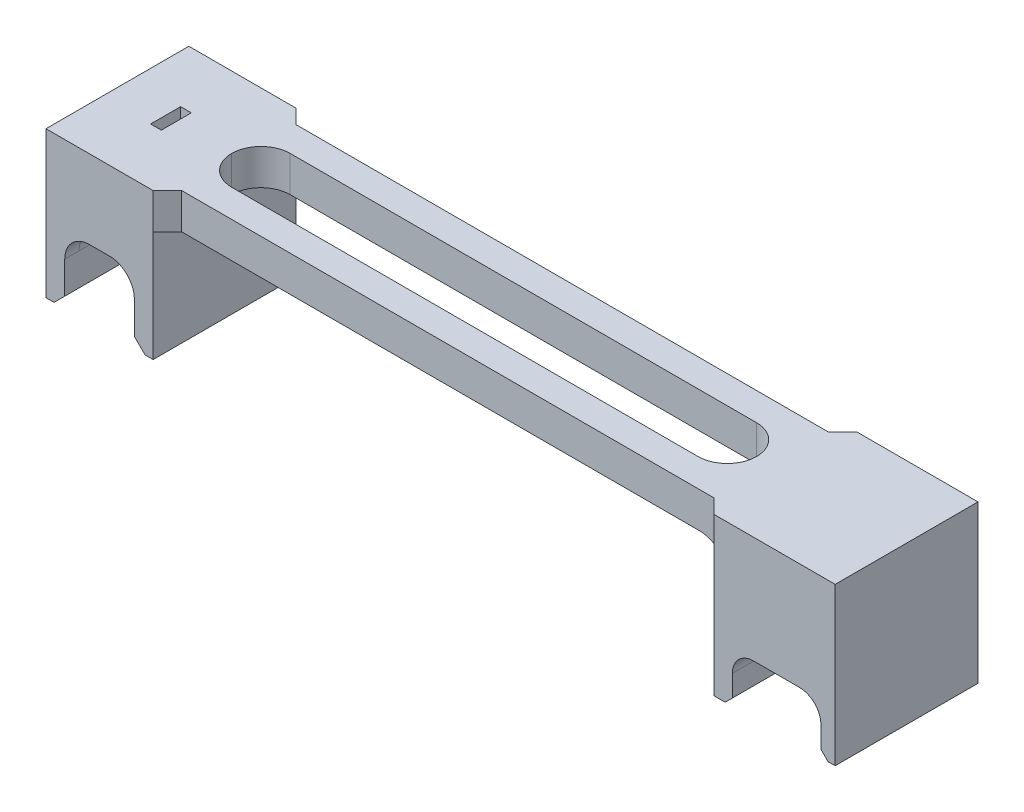
from build123d import *

# Parameters (mm, degrees)
EXTRUDE_1_DEPTH       = 16
SKETCH_4_W            = 1.5
SKETCH_4_H            = 4.2
SKETCH_4_W_2          = 73.5
SKETCH_4_H_2          = 8.2
CUT_EXTRUDE_1_DEPTH   = 10
FILLET_1_R            = 4.1
SKETCH_6_W            = 10
SKETCH_6_H            = 16
SKETCH_6_W_2          = 1.5
SKETCH_6_H_2          = 4.2
EXTRUDE_4_DEPTH       = 11
EXTRUDE_6_DEPTH       = 13
EXTRUDE_6_DEPTH_BACK  = 11
SKETCH_10_W           = 0.125
SKETCH_10_H           = 16
SKETCH_10_W_2         = 2.5
FILLET_2_R            = 3.5
EXTRUDE_7_DEPTH       = 2
EXTRUDE_8_DEPTH       = 2
FILLET_4_R            = 3.5
CUT_EXTRUDE_START     = -15
SKETCH_13_W           = 20
SKETCH_13_H           = 3.5
CUT_EXTRUDE_2_DEPTH   = 15
CHAMFER_1_SIZE        = 2
CHAMFER_2_SIZE        = 1.5
SKETCH_14_W           = 5
SKETCH_14_H           = 16
EXTRUDE_9_DEPTH       = 13
SKETCH_15_W           = 2.6
SKETCH_15_H           = 16
EXTRUDE_10_DEPTH      = 4
EXTRUDE_11_DEPTH      = 2
EXTRUDE_11_DEPTH_BACK = 18
CHAMFER_4_SIZE        = 2
SKETCH_19_W           = 12
SKETCH_19_H           = 20
EXTRUDE_12_DEPTH      = 26.5
SKETCH_20_W           = 10
SKETCH_20_H           = 20
CUT_EXTRUDE_3_DEPTH   = 8.5
FILLET_6_R            = 4
SKETCH_21_W           = 12.4
SKETCH_21_H           = 20
CUT_EXTRUDE_4_DEPTH   = 3
FILLET_7_R            = 3
SKETCH_22_W           = 20
SKETCH_22_H           = 4.5
CUT_EXTRUDE_5_DEPTH   = 3
CHAMFER_5_SIZE        = 1


# Some blends are built 0.0001 mm under size
with BuildPart() as part:
    # 스케치1 → 보스-돌출1 (new body)
    with BuildSketch(Plane.XY):
        Polygon((-96, 0), (0, 0), (0, -21.5), (7.6, -21.5), (7.6, 5), (-96, 5), align=None)
    extrude(amount=EXTRUDE_1_DEPTH)

    # 스케치4 → 컷-돌출1 (cut)
    with BuildSketch(Plane.XZ):
        with Locations((-91, 8)):
            Rectangle(SKETCH_4_W, SKETCH_4_H)
        with Locations((-45.75, 8)):
            Rectangle(SKETCH_4_W_2, SKETCH_4_H_2)
    extrude(amount=-CUT_EXTRUDE_1_DEPTH, mode=Mode.SUBTRACT)

    # 필렛1
    fillet_1_edges = [part.edges().sort_by_distance(p)[0] for p in [
        (-82.5, 2.5, 3.9),
        (-82.5, 2.5, 12.1),
        (-9, 2.5, 3.9),
        (-9, 2.5, 12.1),
    ]]
    fillet(fillet_1_edges, radius=FILLET_1_R - 0.0001)  # a hair under: the kernel refuses the full size

    # 스케치6 → 보스-돌출4 (add)
    with BuildSketch(Plane(origin=(0, 5, 0), x_dir=(1, 0, 0), z_dir=(0, 1, 0))):
        with Locations((-91, -8)):
            Rectangle(SKETCH_6_W, SKETCH_6_H)
        with Locations((-91, -8)):
            Rectangle(SKETCH_6_W_2, SKETCH_6_H_2, mode=Mode.SUBTRACT)
    extrude(amount=-EXTRUDE_4_DEPTH)

    # 스케치10 → 보스-돌출6 (add, two sides: drawn at the far end of the back side and taken through both)
    with BuildSketch(Plane.XZ.offset(6).offset(-EXTRUDE_6_DEPTH_BACK)):
        with Locations((-95.9375, 8)):
            Rectangle(SKETCH_10_W, SKETCH_10_H)
        with Locations((-97.25, 8)):
            Rectangle(SKETCH_10_W_2, SKETCH_10_H)
        with Locations((-86.0625, 8)):
            Rectangle(SKETCH_10_W, SKETCH_10_H)
        with Locations((-84.75, 8)):
            Rectangle(SKETCH_10_W_2, SKETCH_10_H)
    extrude(amount=EXTRUDE_6_DEPTH + EXTRUDE_6_DEPTH_BACK)

    # 필렛2
    fillet_2_edges = [part.edges().sort_by_distance(p)[0] for p in [
        (-95.875, -6, 8),
        (-86.125, -6, 8),
    ]]
    fillet(fillet_2_edges, radius=FILLET_2_R)

    # 스케치11 → 보스-돌출7 (add)
    with BuildSketch(Plane.XY.offset(16)):
        Polygon((-98.5, 5), (-98.5, -19), (-95.875, -19), (-95.875, -6), (-86.125, -6), (-86.125, -19), (-83.5, -19), (-83.5, 5), align=None)
    extrude(amount=EXTRUDE_7_DEPTH)

    # 스케치12 → 보스-돌출8 (add)
    with BuildSketch(Plane(origin=(0, 0, 0), x_dir=(-1, 0, 0), z_dir=(0, 0, -1))):
        Polygon((83.5, 5), (83.5, -19), (86.125, -19), (86.125, -6), (95.875, -6), (95.875, -19), (98.5, -19), (98.5, 5), align=None)
    extrude(amount=EXTRUDE_8_DEPTH)

    # 필렛4
    fillet_4_edges = [part.edges().sort_by_distance(p)[0] for p in [
        (-95.875, -6, -1),
        (-86.125, -6, -1),
        (-86.125, -6, 17),
        (-95.875, -6, 17),
    ]]
    fillet(fillet_4_edges, radius=FILLET_4_R)

    # 스케치13 → 컷-돌출2 (cut)
    with BuildSketch(Plane.ZY.offset(98.5).offset(CUT_EXTRUDE_START)):
        with Locations((8, -17.25)):
            Rectangle(SKETCH_13_W, SKETCH_13_H)
    extrude(amount=CUT_EXTRUDE_2_DEPTH, mode=Mode.SUBTRACT)

    # 모따기1
    chamfer_1_edges = [part.edges().sort_by_distance(p)[0] for p in [
        (-83.5, 2.5, 0),
        (-83.5, 2.5, 16),
    ]]
    chamfer(chamfer_1_edges, length=CHAMFER_1_SIZE - 0.0001)  # a hair under: the kernel refuses the full size

    # 모따기2
    chamfer_2_edges = [part.edges().sort_by_distance(p)[0] for p in [
        (-95.875, -15.5, 8),
        (-86.125, -15.5, 8),
    ]]
    chamfer(chamfer_2_edges, length=CHAMFER_2_SIZE)

    # 스케치14 → 보스-돌출9 (add)
    with BuildSketch(Plane.XZ):
        with Locations((-2.5, 8)):
            Rectangle(SKETCH_14_W, SKETCH_14_H)
    extrude(amount=EXTRUDE_9_DEPTH)

    # 스케치15 → 보스-돌출10 (add)
    with BuildSketch(Plane.XZ.offset(13)):
        with Locations((-3.7, 8)):
            Rectangle(SKETCH_15_W, SKETCH_15_H)
    extrude(amount=EXTRUDE_10_DEPTH)

    # 스케치18 → 보스-돌출11 (add, two sides: drawn at the far end of the back side and taken through both)
    with BuildSketch(Plane.XY.offset(16).offset(-EXTRUDE_11_DEPTH_BACK)):
        Polygon((-5, -17), (-5, 5), (7.6, 5), (7.6, -21.5), (0, -21.5), (0, -13), (-2.4, -13), (-2.4, -17), align=None)
    extrude(amount=EXTRUDE_11_DEPTH + EXTRUDE_11_DEPTH_BACK)

    # 모따기4
    chamfer_4_edges = [part.edges().sort_by_distance(p)[0] for p in [
        (-5, 2.5, 0),
        (-5, 2.5, 16),
    ]]
    chamfer(chamfer_4_edges, length=CHAMFER_4_SIZE - 0.0001)  # a hair under: the kernel refuses the full size

    # 스케치19 → 보스-돌출12 (add)
    with BuildSketch(Plane.XZ.offset(21.5)):
        with Locations((6, 8)):
            Rectangle(SKETCH_19_W, SKETCH_19_H)
    extrude(amount=-EXTRUDE_12_DEPTH)

    # 스케치20 → 컷-돌출3 (cut)
    with BuildSketch(Plane.XZ.offset(21.5)):
        with Locations((5, 8)):
            Rectangle(SKETCH_20_W, SKETCH_20_H)
    extrude(amount=-CUT_EXTRUDE_3_DEPTH, mode=Mode.SUBTRACT)

    # 필렛6
    # the kernel refuses this fillet: 4 mm, written as the material it adds along each edge
    with BuildSketch(Plane(origin=(-5, 0, -11.9999), x_dir=(-1, 0, 0), z_dir=(0, 0, 1))) as fillet_6_piece_1_section:
        with BuildLine():
            CenterArc((FILLET_6_R, FILLET_6_R), FILLET_6_R, 180, 90)
            Line((0, FILLET_6_R), (0, 0))
            Line((0, 0), (FILLET_6_R, 0))
        make_face()
    fillet_6_piece_1 = extrude(amount=39.9998, mode=Mode.PRIVATE)
    fillet_6_piece_1 = split(fillet_6_piece_1, bisect_by=Plane(origin=(-5.422654617, -1.217149551, 0), z_dir=(0, 0, -1)), keep=Keep.TOP, mode=Mode.PRIVATE)
    fillet_6_piece_1 = split(fillet_6_piece_1, bisect_by=Plane(origin=(-5.818327379, -1.217149551, -1.181572621), z_dir=(0.7071067811865476, 0, 0.7071067811865476)), keep=Keep.TOP, mode=Mode.PRIVATE)
    fillet_6_piece_1 = split(fillet_6_piece_1, bisect_by=Plane(origin=(-5.422654617, -1.217149551, -2), z_dir=(0, 0, 1)), keep=Keep.TOP, mode=Mode.PRIVATE)
    add(fillet_6_piece_1)
    with BuildSketch(Plane(origin=(-5, 0, -11.9999), x_dir=(-1, 0, 0), z_dir=(0, 0, 1))) as fillet_6_piece_2_section:
        with BuildLine():
            CenterArc((FILLET_6_R, FILLET_6_R), FILLET_6_R, 180, 90)
            Line((0, FILLET_6_R), (0, 0))
            Line((0, 0), (FILLET_6_R, 0))
        make_face()
    fillet_6_piece_2 = extrude(amount=39.9998, mode=Mode.PRIVATE)
    fillet_6_piece_2 = split(fillet_6_piece_2, bisect_by=Plane(origin=(-8.054414612, -0.03475648, 0), z_dir=(0, 0, 1)), keep=Keep.TOP, mode=Mode.PRIVATE)
    fillet_6_piece_2 = split(fillet_6_piece_2, bisect_by=Plane(origin=(-7.790785959, -0.03475648, 0.790885959), z_dir=(-0.7071067811865476, 0, -0.7071067811865476)), keep=Keep.TOP, mode=Mode.PRIVATE)
    add(fillet_6_piece_2)
    with BuildSketch(Plane(origin=(-5, 0, -11.9999), x_dir=(-1, 0, 0), z_dir=(0, 0, 1))) as fillet_6_piece_3_section:
        with BuildLine():
            CenterArc((FILLET_6_R, FILLET_6_R), FILLET_6_R, 180, 90)
            Line((0, FILLET_6_R), (0, 0))
            Line((0, 0), (FILLET_6_R, 0))
        make_face()
    fillet_6_piece_3 = extrude(amount=39.9998, mode=Mode.PRIVATE)
    fillet_6_piece_3 = split(fillet_6_piece_3, bisect_by=Plane(origin=(-5.88355316, -0.914507111, 0), z_dir=(0, 0, 1)), keep=Keep.TOP, mode=Mode.PRIVATE)
    fillet_6_piece_3 = split(fillet_6_piece_3, bisect_by=Plane(origin=(-5.88355316, -0.914507111, 16), z_dir=(0, 0, -1)), keep=Keep.TOP, mode=Mode.PRIVATE)
    fillet_6_piece_3 = split(fillet_6_piece_3, bisect_by=Plane(origin=(-10.44172658, -0.914507111, 12.55817342), z_dir=(0.7071067811865476, 0, -0.7071067811865476)), keep=Keep.TOP, mode=Mode.PRIVATE)
    fillet_6_piece_3 = split(fillet_6_piece_3, bisect_by=Plane(origin=(-10.44172658, -0.914507111, 3.44182658), z_dir=(0.7071067811865476, 0, 0.7071067811865476)), keep=Keep.TOP, mode=Mode.PRIVATE)
    add(fillet_6_piece_3)
    with BuildSketch(Plane(origin=(-5, 0, -11.9999), x_dir=(-1, 0, 0), z_dir=(0, 0, 1))) as fillet_6_piece_4_section:
        with BuildLine():
            CenterArc((FILLET_6_R, FILLET_6_R), FILLET_6_R, 180, 90)
            Line((0, FILLET_6_R), (0, 0))
            Line((0, 0), (FILLET_6_R, 0))
        make_face()
    fillet_6_piece_4 = extrude(amount=39.9998, mode=Mode.PRIVATE)
    fillet_6_piece_4 = split(fillet_6_piece_4, bisect_by=Plane(origin=(-5.422654617, -1.217149551, 16), z_dir=(0, 0, 1)), keep=Keep.TOP, mode=Mode.PRIVATE)
    fillet_6_piece_4 = split(fillet_6_piece_4, bisect_by=Plane(origin=(-5.818327379, -1.217149551, 17.181572621), z_dir=(0.7071067811865476, 0, -0.7071067811865476)), keep=Keep.TOP, mode=Mode.PRIVATE)
    fillet_6_piece_4 = split(fillet_6_piece_4, bisect_by=Plane(origin=(-5.422654617, -1.217149551, 18), z_dir=(0, 0, -1)), keep=Keep.TOP, mode=Mode.PRIVATE)
    add(fillet_6_piece_4)
    with BuildSketch(Plane(origin=(-5, 0, -11.9999), x_dir=(-1, 0, 0), z_dir=(0, 0, 1))) as fillet_6_piece_5_section:
        with BuildLine():
            CenterArc((FILLET_6_R, FILLET_6_R), FILLET_6_R, 180, 90)
            Line((0, FILLET_6_R), (0, 0))
            Line((0, 0), (FILLET_6_R, 0))
        make_face()
    fillet_6_piece_5 = extrude(amount=39.9998, mode=Mode.PRIVATE)
    fillet_6_piece_5 = split(fillet_6_piece_5, bisect_by=Plane(origin=(-8.054414612, -0.03475648, 16), z_dir=(0, 0, -1)), keep=Keep.TOP, mode=Mode.PRIVATE)
    fillet_6_piece_5 = split(fillet_6_piece_5, bisect_by=Plane(origin=(-7.790785959, -0.03475648, 15.209114041), z_dir=(-0.7071067811865476, 0, 0.7071067811865476)), keep=Keep.TOP, mode=Mode.PRIVATE)
    add(fillet_6_piece_5)

    # 스케치21 → 컷-돌출4 (cut)
    with BuildSketch(Plane.XZ.offset(13)):
        with Locations((3.8, 8)):
            Rectangle(SKETCH_21_W, SKETCH_21_H)
    extrude(amount=-CUT_EXTRUDE_4_DEPTH, mode=Mode.SUBTRACT)

    # 필렛7
    fillet_7_edges = [part.edges().sort_by_distance(p)[0] for p in [
        (10, -10, 8),
        (-2.4, -10, 8),
    ]]
    fillet(fillet_7_edges, radius=FILLET_7_R)

    # 스케치22 → 컷-돌출5 (cut)
    with BuildSketch(Plane.ZY.offset(-10)):
        with Locations((8, -19.25)):
            Rectangle(SKETCH_22_W, SKETCH_22_H)
    extrude(amount=-CUT_EXTRUDE_5_DEPTH, mode=Mode.SUBTRACT)

    # 모따기5
    chamfer_5_edges = [part.edges().sort_by_distance(p)[0] for p in [
        (-2.4, -17, 8),
        (10, -17, 8),
    ]]
    chamfer(chamfer_5_edges, length=CHAMFER_5_SIZE)


solid = part.part
